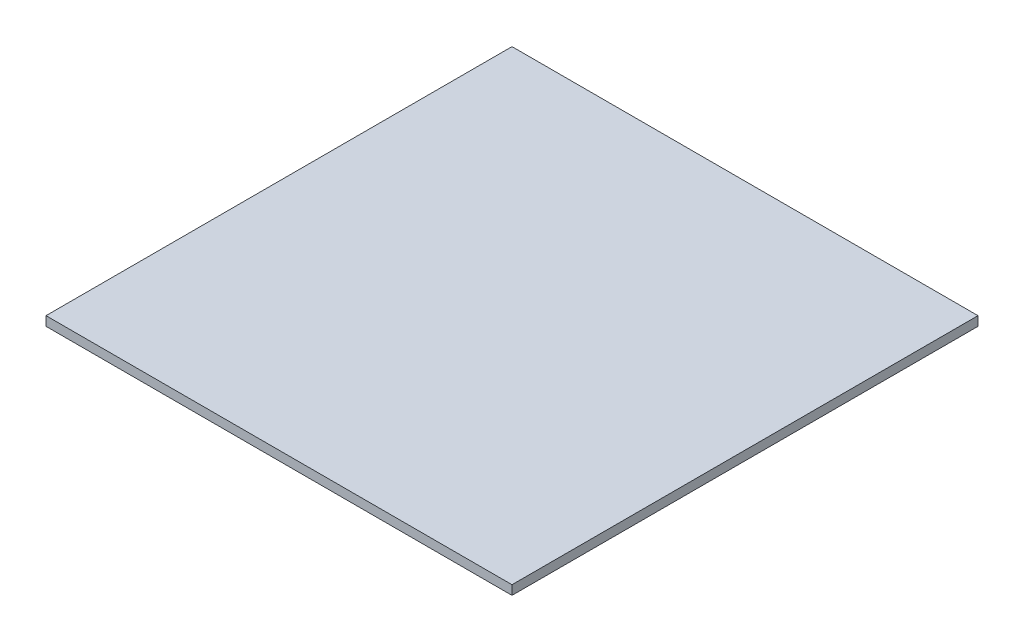
from build123d import *

# Parameters (mm, degrees)
SKETCH1_W           = 108.712
SKETCH1_H           = 108.712
MAIN_PLATE_DEPTH    = 6.35
SKETCH2_W           = 127.762
SKETCH2_H           = 127.762
BOSS_EXTRUDE2_DEPTH = 2.54


with BuildPart() as part:
    # Sketch1 → Main Plate (new body)
    with BuildSketch(Plane(origin=(0, 0, 0), x_dir=(1, 0, 0), z_dir=(0, 1, 0))):
        with Locations((-54.356, 54.356)):
            Rectangle(SKETCH1_W, SKETCH1_H)
    extrude(amount=MAIN_PLATE_DEPTH)

    # Sketch2 → Boss-Extrude2 (add)
    with BuildSketch(Plane(origin=(0, 6.35, 0), x_dir=(1, 0, 0), z_dir=(0, 1, 0))):
        with Locations((-54.356, 54.356)):
            Rectangle(SKETCH2_W, SKETCH2_H)
    extrude(amount=BOSS_EXTRUDE2_DEPTH)


solid = part.part
